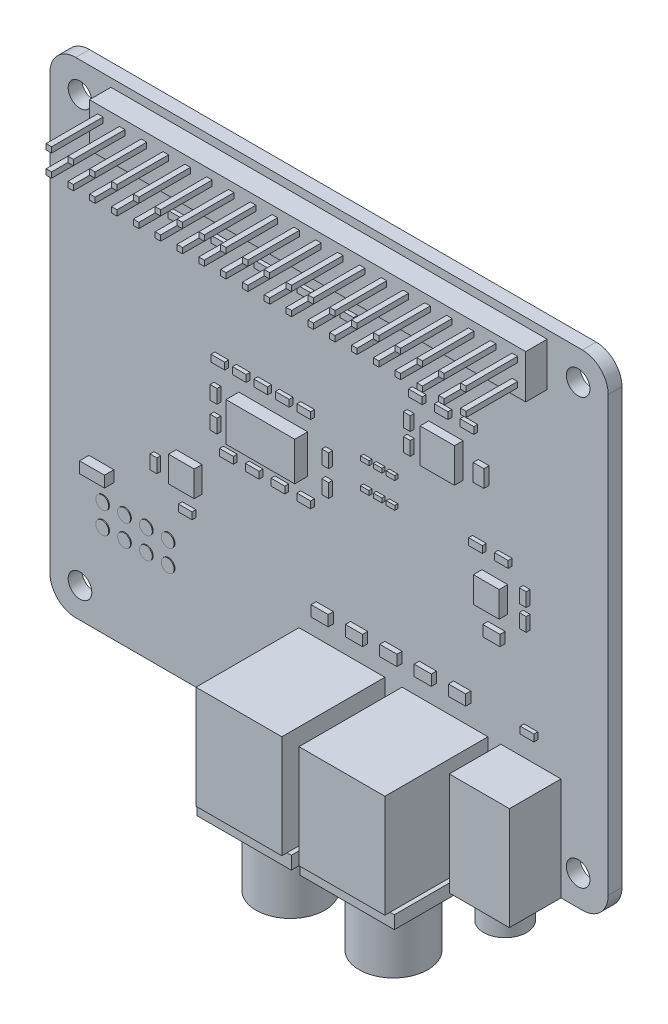
from build123d import *

# Parameters (mm, degrees)
PCB_DEPTH              = 1.6
SKETCH2_W              = 50.8
SKETCH2_H              = 5.08
HEADER_BLOCK_DEPTH     = 2.5
SKETCH3_W              = 0.64
SKETCH3_H              = 0.64
HEADER_PINS_DEPTH      = 6
SKETCH4_W              = 8
SKETCH4_H              = 4.5
IC_DAC_DEPTH           = 1.5
SKETCH5_W              = 1
SKETCH5_H              = 0.5
SMD_H0_35_DEPTH        = 0.35
SKETCH6_W              = 1.6
SKETCH6_H              = 0.8
SKETCH6_W_2            = 0.8
SKETCH6_H_2            = 1.6
SMD_H0_45_DEPTH        = 0.45
SKETCH7_W              = 1.25
SKETCH7_H              = 2
SKETCH7_W_2            = 2
SKETCH7_H_2            = 1.25
SMD_H0_6_DEPTH         = 0.6
SKETCH8_W              = 3
SKETCH8_H              = 3
SMD_H0_9_DEPTH         = 0.9
SKETCH9_W              = 4
SKETCH9_H              = 4
SKETCH9_W_2            = 3
SKETCH9_H_2            = 3
SMD_H1_DEPTH           = 1
SKETCH10_W             = 2.9
SKETCH10_H             = 1.3
SMD_H1_1_DEPTH         = 1.1
SKETCH11_R             = 0.75
TEST_PADS_DEPTH        = 0.1
SKETCH12_W             = 10
SKETCH12_H             = 12
RCA_HOUSINGS_DEPTH     = 12
SKETCH13_W             = 11
SKETCH13_H             = 12
RCA_FLANGES_DEPTH      = 1.5
SKETCH14_R             = 4
RCA_BARRELS_DEPTH      = 9
SKETCH15_W             = 7
SKETCH15_H             = 12
JACK_BODY_DEPTH        = 6
SKETCH16_R             = 2.5
JACK_NOSE_DEPTH        = 2.5
SKETCH17_R             = 2.5
RCA_BORES_DEPTH        = 9
SKETCH18_R             = 1.75
JACK_BORE_DEPTH        = 2.5
MOUNT_HOLES_DEPTH      = 88.190653169
MOUNT_HOLES_DEPTH_BACK = 88.190653169
SKETCH19_R             = 1.375


with BuildPart() as part:
    # Sketch1 → PCB (new body)
    with BuildSketch(Plane.XY):
        with BuildLine():
            Line((3, 0), (62, 0))
            ThreePointArc((62, 0), (64.121320344, 0.878679656), (65, 3))
            Line((65, 3), (65, 53.5))
            ThreePointArc((65, 53.5), (64.121320344, 55.621320344), (62, 56.5))
            Line((62, 56.5), (3, 56.5))
            ThreePointArc((3, 56.5), (0.878679656, 55.621320344), (0, 53.5))
            Line((0, 53.5), (0, 3))
            ThreePointArc((0, 3), (0.878679656, 0.878679656), (3, 0))
        make_face()
    extrude(amount=PCB_DEPTH)

    # Sketch2 → Header_Block (add)
    with BuildSketch(Plane.XY.offset(1.6)):
        with Locations((32.5, 53)):
            Rectangle(SKETCH2_W, SKETCH2_H)
    extrude(amount=HEADER_BLOCK_DEPTH)

    # Sketch3 → Header_Pins (add)
    with BuildSketch(Plane.XY.offset(4.1)):
        with Locations((8.37, 51.73)):
            Rectangle(SKETCH3_W, SKETCH3_H)
        with Locations((8.37, 54.27)):
            Rectangle(SKETCH3_W, SKETCH3_H)
        with Locations((10.91, 51.73)):
            Rectangle(SKETCH3_W, SKETCH3_H)
        with Locations((10.91, 54.27)):
            Rectangle(SKETCH3_W, SKETCH3_H)
        with Locations((13.45, 51.73)):
            Rectangle(SKETCH3_W, SKETCH3_H)
        with Locations((13.45, 54.27)):
            Rectangle(SKETCH3_W, SKETCH3_H)
        with Locations((15.99, 51.73)):
            Rectangle(SKETCH3_W, SKETCH3_H)
        with Locations((15.99, 54.27)):
            Rectangle(SKETCH3_W, SKETCH3_H)
        with Locations((18.53, 51.73)):
            Rectangle(SKETCH3_W, SKETCH3_H)
        with Locations((18.53, 54.27)):
            Rectangle(SKETCH3_W, SKETCH3_H)
        with Locations((21.07, 51.73)):
            Rectangle(SKETCH3_W, SKETCH3_H)
        with Locations((21.07, 54.27)):
            Rectangle(SKETCH3_W, SKETCH3_H)
        with Locations((23.61, 51.73)):
            Rectangle(SKETCH3_W, SKETCH3_H)
        with Locations((23.61, 54.27)):
            Rectangle(SKETCH3_W, SKETCH3_H)
        with Locations((26.15, 51.73)):
            Rectangle(SKETCH3_W, SKETCH3_H)
        with Locations((26.15, 54.27)):
            Rectangle(SKETCH3_W, SKETCH3_H)
        with Locations((28.69, 51.73)):
            Rectangle(SKETCH3_W, SKETCH3_H)
        with Locations((28.69, 54.27)):
            Rectangle(SKETCH3_W, SKETCH3_H)
        with Locations((31.23, 51.73)):
            Rectangle(SKETCH3_W, SKETCH3_H)
        with Locations((31.23, 54.27)):
            Rectangle(SKETCH3_W, SKETCH3_H)
        with Locations((33.77, 51.73)):
            Rectangle(SKETCH3_W, SKETCH3_H)
        with Locations((33.77, 54.27)):
            Rectangle(SKETCH3_W, SKETCH3_H)
        with Locations((36.31, 51.73)):
            Rectangle(SKETCH3_W, SKETCH3_H)
        with Locations((36.31, 54.27)):
            Rectangle(SKETCH3_W, SKETCH3_H)
        with Locations((38.85, 51.73)):
            Rectangle(SKETCH3_W, SKETCH3_H)
        with Locations((38.85, 54.27)):
            Rectangle(SKETCH3_W, SKETCH3_H)
        with Locations((41.39, 51.73)):
            Rectangle(SKETCH3_W, SKETCH3_H)
        with Locations((41.39, 54.27)):
            Rectangle(SKETCH3_W, SKETCH3_H)
        with Locations((43.93, 51.73)):
            Rectangle(SKETCH3_W, SKETCH3_H)
        with Locations((43.93, 54.27)):
            Rectangle(SKETCH3_W, SKETCH3_H)
        with Locations((46.47, 51.73)):
            Rectangle(SKETCH3_W, SKETCH3_H)
        with Locations((46.47, 54.27)):
            Rectangle(SKETCH3_W, SKETCH3_H)
        with Locations((49.01, 51.73)):
            Rectangle(SKETCH3_W, SKETCH3_H)
        with Locations((49.01, 54.27)):
            Rectangle(SKETCH3_W, SKETCH3_H)
        with Locations((51.55, 51.73)):
            Rectangle(SKETCH3_W, SKETCH3_H)
        with Locations((51.55, 54.27)):
            Rectangle(SKETCH3_W, SKETCH3_H)
        with Locations((54.09, 51.73)):
            Rectangle(SKETCH3_W, SKETCH3_H)
        with Locations((54.09, 54.27)):
            Rectangle(SKETCH3_W, SKETCH3_H)
        with Locations((56.63, 51.73)):
            Rectangle(SKETCH3_W, SKETCH3_H)
        with Locations((56.63, 54.27)):
            Rectangle(SKETCH3_W, SKETCH3_H)
    extrude(amount=HEADER_PINS_DEPTH)

    # Sketch4 → IC_DAC (add)
    with BuildSketch(Plane.XY.offset(1.6)):
        with Locations((26, 30)):
            Rectangle(SKETCH4_W, SKETCH4_H)
    extrude(amount=IC_DAC_DEPTH)

    # Sketch5 → SMD_h0_35 (add)
    with BuildSketch(Plane.XY.offset(1.6)):
        with Locations((37, 30)):
            Rectangle(SKETCH5_W, SKETCH5_H)
        with Locations((38.5, 30)):
            Rectangle(SKETCH5_W, SKETCH5_H)
        with Locations((40, 30)):
            Rectangle(SKETCH5_W, SKETCH5_H)
        with Locations((37, 33)):
            Rectangle(SKETCH5_W, SKETCH5_H)
        with Locations((38.5, 33)):
            Rectangle(SKETCH5_W, SKETCH5_H)
        with Locations((40, 33)):
            Rectangle(SKETCH5_W, SKETCH5_H)
    extrude(amount=SMD_H0_35_DEPTH)

    # Sketch6 → SMD_h0_45 (add)
    with BuildSketch(Plane.XY.offset(1.6)):
        with Locations((20, 34.5)):
            Rectangle(SKETCH6_W, SKETCH6_H)
        with Locations((22.5, 34.5)):
            Rectangle(SKETCH6_W, SKETCH6_H)
        with Locations((25, 34.5)):
            Rectangle(SKETCH6_W, SKETCH6_H)
        with Locations((27.5, 34.5)):
            Rectangle(SKETCH6_W, SKETCH6_H)
        with Locations((30, 34.5)):
            Rectangle(SKETCH6_W, SKETCH6_H)
        with Locations((21, 25.5)):
            Rectangle(SKETCH6_W, SKETCH6_H)
        with Locations((24, 25.5)):
            Rectangle(SKETCH6_W, SKETCH6_H)
        with Locations((27, 25.5)):
            Rectangle(SKETCH6_W, SKETCH6_H)
        with Locations((30, 25.5)):
            Rectangle(SKETCH6_W, SKETCH6_H)
        with Locations((19.5, 28)):
            Rectangle(SKETCH6_W_2, SKETCH6_H_2)
        with Locations((19.5, 31)):
            Rectangle(SKETCH6_W_2, SKETCH6_H_2)
        with Locations((32.5, 28)):
            Rectangle(SKETCH6_W_2, SKETCH6_H_2)
        with Locations((32.5, 31)):
            Rectangle(SKETCH6_W_2, SKETCH6_H_2)
        with Locations((43, 42.5)):
            Rectangle(SKETCH6_W, SKETCH6_H)
        with Locations((46, 42.5)):
            Rectangle(SKETCH6_W, SKETCH6_H)
        with Locations((49, 42.5)):
            Rectangle(SKETCH6_W, SKETCH6_H)
        with Locations((42, 37)):
            Rectangle(SKETCH6_W_2, SKETCH6_H_2)
        with Locations((42, 39.5)):
            Rectangle(SKETCH6_W_2, SKETCH6_H_2)
        with Locations((55.5, 26)):
            Rectangle(SKETCH6_W_2, SKETCH6_H_2)
        with Locations((55.5, 28.5)):
            Rectangle(SKETCH6_W_2, SKETCH6_H_2)
        with Locations((50, 31)):
            Rectangle(SKETCH6_W, SKETCH6_H)
        with Locations((53, 31)):
            Rectangle(SKETCH6_W, SKETCH6_H)
        with Locations((56, 15)):
            Rectangle(SKETCH6_W, SKETCH6_H)
        with Locations((15, 46.5)):
            Rectangle(SKETCH6_W, SKETCH6_H)
        with Locations((20, 46.5)):
            Rectangle(SKETCH6_W, SKETCH6_H)
        with Locations((25, 46.5)):
            Rectangle(SKETCH6_W, SKETCH6_H)
        with Locations((30, 46.5)):
            Rectangle(SKETCH6_W, SKETCH6_H)
        with Locations((35, 46.5)):
            Rectangle(SKETCH6_W, SKETCH6_H)
        with Locations((12.5, 20.5)):
            Rectangle(SKETCH6_W_2, SKETCH6_H_2)
        with Locations((16.2, 17.5)):
            Rectangle(SKETCH6_W, SKETCH6_H)
    extrude(amount=SMD_H0_45_DEPTH)

    # Sketch7 → SMD_h0_6 (add)
    with BuildSketch(Plane.XY.offset(1.6)):
        with Locations((50.5, 38.4)):
            Rectangle(SKETCH7_W, SKETCH7_H)
        with Locations((52, 23)):
            Rectangle(SKETCH7_W_2, SKETCH7_H_2)
        with Locations((32, 15)):
            Rectangle(SKETCH7_W_2, SKETCH7_H_2)
        with Locations((36, 15)):
            Rectangle(SKETCH7_W_2, SKETCH7_H_2)
        with Locations((40, 15)):
            Rectangle(SKETCH7_W_2, SKETCH7_H_2)
        with Locations((44, 15)):
            Rectangle(SKETCH7_W_2, SKETCH7_H_2)
        with Locations((48, 15)):
            Rectangle(SKETCH7_W_2, SKETCH7_H_2)
    extrude(amount=SMD_H0_6_DEPTH)

    # Sketch8 → SMD_h0_9 (add)
    with BuildSketch(Plane.XY.offset(1.6)):
        with Locations((16.2, 21.3)):
            Rectangle(SKETCH8_W, SKETCH8_H)
    extrude(amount=SMD_H0_9_DEPTH)

    # Sketch9 → SMD_h1 (add)
    with BuildSketch(Plane.XY.offset(1.6)):
        with Locations((46.1, 38.4)):
            Rectangle(SKETCH9_W, SKETCH9_H)
        with Locations((51.8, 27)):
            Rectangle(SKETCH9_W_2, SKETCH9_H_2)
    extrude(amount=SMD_H1_DEPTH)

    # Sketch10 → SMD_h1_1 (add)
    with BuildSketch(Plane.XY.offset(1.6)):
        with Locations((6, 16.5)):
            Rectangle(SKETCH10_W, SKETCH10_H)
    extrude(amount=SMD_H1_1_DEPTH)

    # Sketch11 → Test_Pads (add)
    with BuildSketch(Plane.XY.offset(1.6)):
        with Locations((6.19, 10.73)):
            Circle(SKETCH11_R)
        with Locations((6.19, 13.27)):
            Circle(SKETCH11_R)
        with Locations((8.73, 10.73)):
            Circle(SKETCH11_R)
        with Locations((8.73, 13.27)):
            Circle(SKETCH11_R)
        with Locations((11.27, 10.73)):
            Circle(SKETCH11_R)
        with Locations((11.27, 13.27)):
            Circle(SKETCH11_R)
        with Locations((13.81, 10.73)):
            Circle(SKETCH11_R)
        with Locations((13.81, 13.27)):
            Circle(SKETCH11_R)
    extrude(amount=TEST_PADS_DEPTH)

    # Sketch12 → RCA_Housings (add)
    with BuildSketch(Plane.XY.offset(1.6)):
        with Locations((34, 6)):
            Rectangle(SKETCH12_W, SKETCH12_H)
        with Locations((46, 6)):
            Rectangle(SKETCH12_W, SKETCH12_H)
    extrude(amount=RCA_HOUSINGS_DEPTH)

    # Sketch13 → RCA_Flanges (add)
    with BuildSketch(Plane(origin=(0, 0, 0), x_dir=(1, 0, 0), z_dir=(0, 1, 0))):
        with Locations((34, -7)):
            Rectangle(SKETCH13_W, SKETCH13_H)
        with Locations((46, -7)):
            Rectangle(SKETCH13_W, SKETCH13_H)
    extrude(amount=-RCA_FLANGES_DEPTH)

    # Sketch14 → RCA_Barrels (add)
    with BuildSketch(Plane(origin=(0, 0, 0), x_dir=(1, 0, 0), z_dir=(0, 1, 0))):
        with Locations((34, -7.6)):
            Circle(SKETCH14_R)
        with Locations((46, -7.6)):
            Circle(SKETCH14_R)
    extrude(amount=-RCA_BARRELS_DEPTH)

    # Sketch15 → Jack_Body (add)
    with BuildSketch(Plane.XY.offset(1.6)):
        with Locations((56, 6)):
            Rectangle(SKETCH15_W, SKETCH15_H)
    extrude(amount=JACK_BODY_DEPTH)

    # Sketch16 → Jack_Nose (add)
    with BuildSketch(Plane(origin=(0, 0, 0), x_dir=(1, 0, 0), z_dir=(0, 1, 0))):
        with Locations((56, -4.6)):
            Circle(SKETCH16_R)
    extrude(amount=-JACK_NOSE_DEPTH)

    # Sketch17 → RCA_Bores (cut)
    with BuildSketch(Plane(origin=(0, 0, 0), x_dir=(1, 0, 0), z_dir=(0, 1, 0))):
        with Locations((34, -7.6)):
            Circle(SKETCH17_R)
        with Locations((46, -7.6)):
            Circle(SKETCH17_R)
    extrude(amount=RCA_BORES_DEPTH, mode=Mode.SUBTRACT)

    # Sketch18 → Jack_Bore (cut)
    with BuildSketch(Plane(origin=(0, 0, 0), x_dir=(1, 0, 0), z_dir=(0, 1, 0))):
        with Locations((56, -4.6)):
            Circle(SKETCH18_R)
    extrude(amount=JACK_BORE_DEPTH, mode=Mode.SUBTRACT)

    # Sketch19 → Mount_Holes (cut, two sides: drawn at the far end of the back side and taken through both)
    with BuildSketch(Plane.XY.offset(-MOUNT_HOLES_DEPTH_BACK)):
        with Locations((3.5, 3.5)):
            Circle(SKETCH19_R)
        with Locations((3.5, 53)):
            Circle(SKETCH19_R)
        with Locations((61.5, 3.5)):
            Circle(SKETCH19_R)
        with Locations((61.5, 53)):
            Circle(SKETCH19_R)
    extrude(amount=MOUNT_HOLES_DEPTH + MOUNT_HOLES_DEPTH_BACK, mode=Mode.SUBTRACT)


solid = part.part
